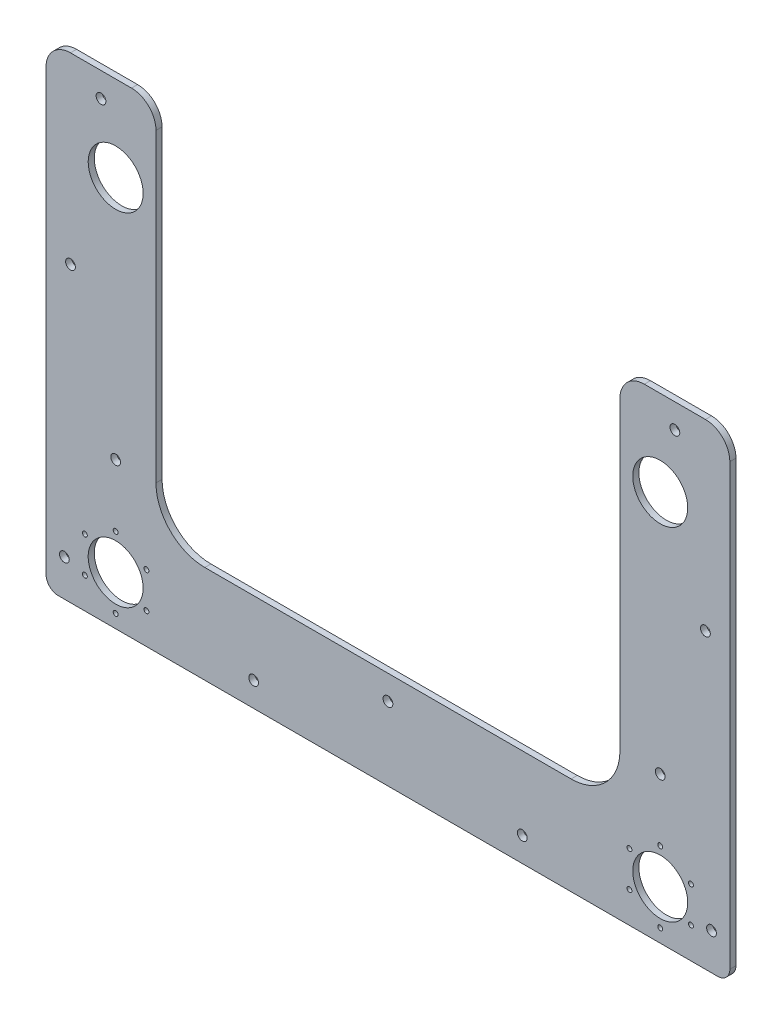
from build123d import *

# Parameters (mm, degrees)
SKETCH1_R           = 14.2875
SKETCH1_R_2         = 1.27
SKETCH1_R_3         = 2.54
BOSS_EXTRUDE3_DEPTH = 3.175


with BuildPart() as part:
    # Sketch1 → Boss-Extrude3 (new body)
    with BuildSketch(Plane.XY):
        with BuildLine():
            Line((120.65, -152.4), (120.65, -6.35))
            Line((120.65, -6.35), (120.65, 6.35))
            ThreePointArc((120.65, 6.35), (124.369743879, 15.330256121), (133.35, 19.05))
            Line((133.35, 19.05), (165.1, 19.05))
            ThreePointArc((165.1, 19.05), (174.080256121, 15.330256121), (177.8, 6.35))
            Line((177.8, 6.35), (177.8, -6.35))
            Line((177.8, -6.35), (177.8, -222.25))
            ThreePointArc((177.8, -222.25), (175.940128061, -226.740128061), (171.45, -228.6))
            Line((171.45, -228.6), (12.7, -228.6))
            Line((12.7, -228.6), (-12.7, -228.6))
            Line((-12.7, -228.6), (-171.45, -228.6))
            ThreePointArc((-171.45, -228.6), (-175.940128061, -226.740128061), (-177.8, -222.25))
            Line((-177.8, -222.25), (-177.8, -6.35))
            Line((-177.8, -6.35), (-177.8, 6.35))
            ThreePointArc((-177.8, 6.35), (-174.080256121, 15.330256121), (-165.1, 19.05))
            Line((-165.1, 19.05), (-133.35, 19.05))
            ThreePointArc((-133.35, 19.05), (-124.369743879, 15.330256121), (-120.65, 6.35))
            Line((-120.65, 6.35), (-120.65, -6.35))
            Line((-120.65, -6.35), (-120.65, -152.4))
            ThreePointArc((-120.65, -152.4), (-113.210512242, -170.360512242), (-95.25, -177.8))
            Line((-95.25, -177.8), (-12.7, -177.8))
            Line((-12.7, -177.8), (12.7, -177.8))
            Line((12.7, -177.8), (95.25, -177.8))
            ThreePointArc((95.25, -177.8), (113.210512242, -170.360512242), (120.65, -152.4))
        make_face()
        with Locations((141.605, -25.4)):
            Circle(SKETCH1_R, mode=Mode.SUBTRACT)
        with Locations((-141.605, -25.4)):
            Circle(SKETCH1_R, mode=Mode.SUBTRACT)
        with Locations((-141.605, -203.2)):
            Circle(SKETCH1_R, mode=Mode.SUBTRACT)
        with Locations((-141.605, -184.722481985)):
            Circle(SKETCH1_R_2, mode=Mode.SUBTRACT)
        with Locations((-125.603, -193.961240992)):
            Circle(SKETCH1_R_2, mode=Mode.SUBTRACT)
        with Locations((-125.603, -212.438759008)):
            Circle(SKETCH1_R_2, mode=Mode.SUBTRACT)
        with Locations((-141.605, -221.677518015)):
            Circle(SKETCH1_R_2, mode=Mode.SUBTRACT)
        with Locations((-157.607, -212.438759008)):
            Circle(SKETCH1_R_2, mode=Mode.SUBTRACT)
        with Locations((-157.607, -193.961240992)):
            Circle(SKETCH1_R_2, mode=Mode.SUBTRACT)
        with Locations((157.607, -212.438759008)):
            Circle(SKETCH1_R_2, mode=Mode.SUBTRACT)
        with Locations((157.607, -193.961240992)):
            Circle(SKETCH1_R_2, mode=Mode.SUBTRACT)
        with Locations((141.605, -184.722481985)):
            Circle(SKETCH1_R_2, mode=Mode.SUBTRACT)
        with Locations((125.603, -193.961240992)):
            Circle(SKETCH1_R_2, mode=Mode.SUBTRACT)
        with Locations((125.603, -212.438759008)):
            Circle(SKETCH1_R_2, mode=Mode.SUBTRACT)
        with Locations((141.605, -221.677518015)):
            Circle(SKETCH1_R_2, mode=Mode.SUBTRACT)
        with Locations((141.605, -203.2)):
            Circle(SKETCH1_R, mode=Mode.SUBTRACT)
        with Locations((-69.85, -215.9)):
            Circle(SKETCH1_R_3, mode=Mode.SUBTRACT)
        with Locations((69.85, -215.9)):
            Circle(SKETCH1_R_3, mode=Mode.SUBTRACT)
        with Locations((0, -190.5)):
            Circle(SKETCH1_R_3, mode=Mode.SUBTRACT)
        with Locations((-141.605, -152.4)):
            Circle(SKETCH1_R_3, mode=Mode.SUBTRACT)
        with Locations((-149.225, 6.35)):
            Circle(SKETCH1_R_3, mode=Mode.SUBTRACT)
        with Locations((141.605, -152.4)):
            Circle(SKETCH1_R_3, mode=Mode.SUBTRACT)
        with Locations((149.225, 6.35)):
            Circle(SKETCH1_R_3, mode=Mode.SUBTRACT)
        with Locations((-168.275, -209.55)):
            Circle(SKETCH1_R_3, mode=Mode.SUBTRACT)
        with Locations((168.275, -209.55)):
            Circle(SKETCH1_R_3, mode=Mode.SUBTRACT)
        with Locations((-165.1, -76.2)):
            Circle(SKETCH1_R_3, mode=Mode.SUBTRACT)
        with Locations((165.1, -76.2)):
            Circle(SKETCH1_R_3, mode=Mode.SUBTRACT)
    extrude(amount=BOSS_EXTRUDE3_DEPTH)


solid = part.part
